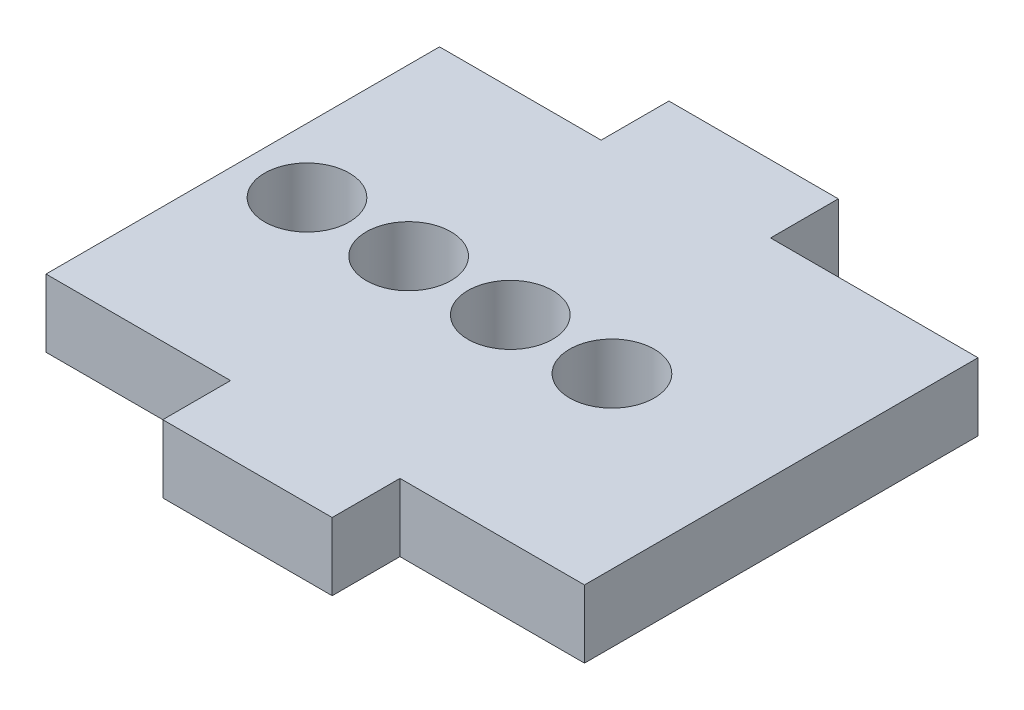
from build123d import *

# Parameters (mm, degrees)
SKETCH1_R           = 2.5
BOSS_EXTRUDE2_DEPTH = 4
SKETCH12_W          = 10
SKETCH12_H          = 4
BOSS_EXTRUDE4_DEPTH = 4
SKETCH14_W          = 10
SKETCH14_H          = 4
BOSS_EXTRUDE5_DEPTH = 4


with BuildPart() as part:
    # Sketch1 → Boss-Extrude2 (new body)
    with BuildSketch(Plane(origin=(0, 0, 0), x_dir=(1, 0, 0), z_dir=(0, 1, 0))):
        Polygon((36.786877756, 11.613831083), (44.492502068, 11.613831083), (44.492502068, -11.613831083), (36.786877756, -11.613831083), (27.518556454, -11.613831083), (12.70818574, -11.613831083), (12.70818574, 11.613831083), (27.518556454, 11.613831083), align=None)
        with Locations((16.5, 0)):
            Circle(SKETCH1_R, mode=Mode.SUBTRACT)
        with Locations((22.5, 0)):
            Circle(SKETCH1_R, mode=Mode.SUBTRACT)
        with Locations((28.5, 0)):
            Circle(SKETCH1_R, mode=Mode.SUBTRACT)
        with Locations((34.5, 0)):
            Circle(SKETCH1_R, mode=Mode.SUBTRACT)
    extrude(amount=BOSS_EXTRUDE2_DEPTH)

    # Sketch12 → Boss-Extrude4 (add)
    with BuildSketch(Plane(origin=(0, 0, -11.613831083), x_dir=(-1, 0, 0), z_dir=(0, 0, -1))):
        with Locations((-27.247531748, 2)):
            Rectangle(SKETCH12_W, SKETCH12_H)
    extrude(amount=BOSS_EXTRUDE4_DEPTH)

    # Sketch14 → Boss-Extrude5 (add)
    with BuildSketch(Plane.XY.offset(11.613831083)):
        with Locations((28.600343904, 2)):
            Rectangle(SKETCH14_W, SKETCH14_H)
    extrude(amount=BOSS_EXTRUDE5_DEPTH)


solid = part.part
